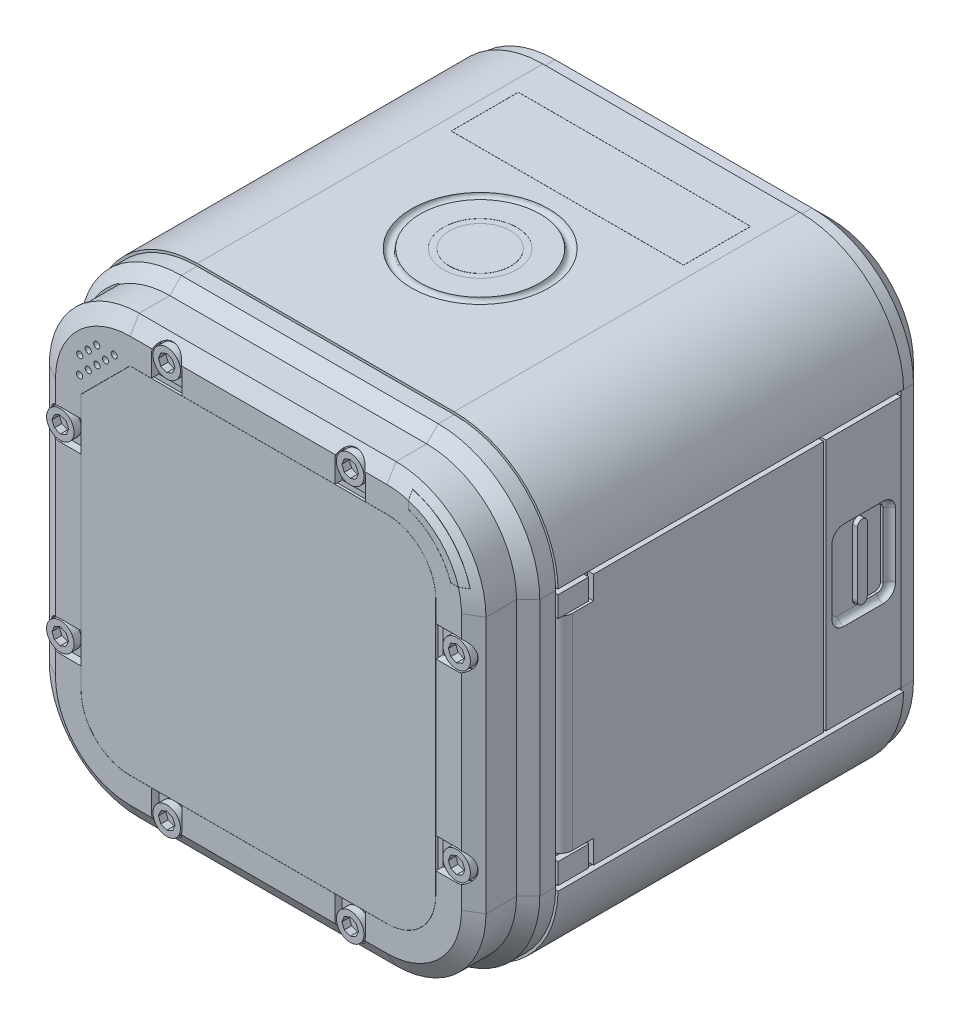
from build123d import *

# Parameters (mm, degrees)
BOSS_EXTRUDE1_DEPTH  = 18.125
FILLET1_R            = 8.5
CUT_EXTRUDE1_DEPTH   = 5.5
SKETCH5_R            = 0.3600000000000003
CUT_EXTRUDE3_DEPTH   = 1
CUT_EXTRUDE4_DEPTH   = 1
CUT_EXTRUDE5_START   = -2.5
CUT_EXTRUDE5_DEPTH   = 2.5
CHAMFER1_SIZE        = 1.5
CUT_EXTRUDE6_DEPTH   = 0.7
SKETCH10_R           = 0.19999999999999993
SKETCH10_R_2         = 0.19999999999999912
SKETCH10_R_3         = 0.20000000000000076
SKETCH10_R_4         = 0.1999999999999986
CUT_EXTRUDE7_DEPTH   = 0.6
SKETCH14_R           = 36.42270023932327
CUT_EXTRUDE8_DEPTH   = 3.25
CHAMFER3_SIZE        = 0.95
SKETCH17_R           = 0.24999999999999958
SKETCH17_R_2         = 0.24999999999999642
SKETCH17_R_3         = 0.24999999999999523
CUT_EXTRUDE9_DEPTH   = 0.5
SKETCH18_R           = 11.5
CUT_EXTRUDE10_DEPTH  = 1.5
SKETCH19_R           = 6
BOSS_EXTRUDE2_DEPTH  = 0.1
SKETCH21_W           = 28.249999999999996
SKETCH21_H           = 0.40000000000000036
CUT_EXTRUDE12_DEPTH  = 0.1
BOSS_EXTRUDE3_DEPTH  = 0.1
SKETCH25_W           = 6.149999999999997
SKETCH25_H           = 20.60000000000001
CUT_EXTRUDE15_DEPTH  = 0.5
FILLET2_R            = 1
CUT_EXTRUDE16_DEPTH  = 0.5
FILLET3_R            = 0.5
SKETCH27_R           = 3
SKETCH27_R_2         = 2.5000000000000004
CUT_EXTRUDE17_DEPTH  = 0.01
CUT_EXTRUDE18_DEPTH  = 0.2
BOSS_EXTRUDE4_DEPTH  = 0.5
BOSS_EXTRUDE5_DEPTH  = 0.5
CUT_EXTRUDE19_DEPTH  = 0.6
SKETCH33_R           = 1.1250000000000007
BOSS_EXTRUDE7_DEPTH  = 0.6
CIRPATTERN1_COUNT    = 4
SKETCH35_R           = 6.999999999999999
SKETCH35_R_2         = 4.000000000000001
CUT_EXTRUDE21_DEPTH  = 1.2
CUT_EXTRUDE22_DEPTH  = 1
BOSS_EXTRUDE8_DEPTH  = 0.2
BOSS_EXTRUDE10_DEPTH = 0.2
CUT_EXTRUDE24_DEPTH  = 2.5
BOSS_EXTRUDE11_DEPTH = 1
CHAMFER4_SIZE        = 0.35
CHAMFER4_SIZE2       = 0.582497818822684
CUT_EXTRUDE25_DEPTH  = 1.5
BOSS_EXTRUDE12_DEPTH = 1.5
CHAMFER5_SIZE        = 0.6


# Read off the part's stored shape, not the designer's step: Dome1
# Some blends are built 0.0001 mm under size
with BuildPart() as part:
    # Sketch1 → Boss-Extrude1 (new, symmetric)
    with BuildSketch(Plane.XY):
        Polygon((18.999999999999996, -18.999999999999996), (-19.000000000000004, -19.000000000000004), (-19.000000000000004, 18.999999999999996), (18.999999999999996, 19.000000000000004), align=None)
    extrude(amount=BOSS_EXTRUDE1_DEPTH, both=True)

    # Fillet1
    fillet1_edges = [part.edges().sort_by_distance(p)[0] for p in [
        (-19.000000000000004, 18.999999999999996, 0),
        (18.999999999999996, 19.000000000000004, 0),
        (18.999999999999996, -18.999999999999996, 0),
        (-19.000000000000004, -19.000000000000004, 0),
    ]]
    fillet(fillet1_edges, radius=FILLET1_R)

    # Sketch2 → Cut-Extrude1 (cut)
    with BuildSketch(Plane.XY.offset(18.125)):
        with BuildLine():
            Line((10.499999999999993, 19.000000000000004), (-10.500000000000002, 18.999999999999996))
            ThreePointArc((-10.500000000000002, 18.999999999999996), (-16.510407640085656, 16.51040764008565), (-19.000000000000004, 10.499999999999995))
            Line((-19.000000000000004, 10.499999999999995), (-19.000000000000004, -10.5))
            ThreePointArc((-19.000000000000004, -10.5), (-16.51040764008566, -16.510407640085653), (-10.500000000000002, -19.000000000000004))
            Line((-10.500000000000002, -19.000000000000004), (10.499999999999996, -18.999999999999996))
            ThreePointArc((10.499999999999996, -18.999999999999996), (16.51040764008565, -16.51040764008565), (18.999999999999996, -10.499999999999996))
            Line((18.999999999999996, -10.499999999999996), (18.999999999999996, 10.500000000000002))
            ThreePointArc((18.999999999999996, 10.500000000000002), (16.51040764008565, 16.510407640085656), (10.499999999999993, 19.000000000000004))
        make_face()
        with BuildLine():
            Line((-18.800000000000004, 10.499999999999996), (-18.800000000000004, -10.500000000000002))
            ThreePointArc((-18.800000000000004, -10.500000000000002), (-16.368986283848347, -16.368986283848347), (-10.500000000000004, -18.8))
            Line((-10.500000000000004, -18.8), (10.499999999999995, -18.800000000000004))
            ThreePointArc((10.499999999999995, -18.800000000000004), (16.368986283848344, -16.368986283848347), (18.799999999999997, -10.499999999999998))
            Line((18.799999999999997, -10.499999999999998), (18.799999999999997, 10.5))
            ThreePointArc((18.799999999999997, 10.5), (16.36898628384834, 16.368986283848347), (10.499999999999993, 18.8))
            Line((10.499999999999993, 18.8), (-10.500000000000002, 18.799999999999997))
            ThreePointArc((-10.500000000000002, 18.799999999999997), (-16.368986283848347, 16.36898628384834), (-18.800000000000004, 10.499999999999996))
        make_face(mode=Mode.SUBTRACT)
    extrude(amount=-CUT_EXTRUDE1_DEPTH, mode=Mode.SUBTRACT)

    # Sketch5 → Cut-Revolve1 (revolve, cut)
    with BuildSketch(Plane.XY):
        with Locations((-5.25, 18.999999999999996)):
            Circle(SKETCH5_R)
    revolve(axis=Axis((0, 0, 0), (0, 1, 0)), mode=Mode.SUBTRACT)

    # Sketch6 → Cut-Extrude3 (cut)
    with BuildSketch(Plane(origin=(-3.47e-15, 19, 0), x_dir=(1, 1.8e-16, 0), z_dir=(-1.8e-16, 1, 0))):
        Polygon((-9.499999999999995, 12.624999999999998), (9.500000000000005, 12.624999999999996), (9.500000000000005, 7.124999999999999), (-9.499999999999996, 7.124999999999999), align=None)
    extrude(amount=-CUT_EXTRUDE3_DEPTH, mode=Mode.SUBTRACT)

    # Sketch7 → Cut-Extrude4 (cut)
    with BuildSketch(Plane.XY.offset(18.125)):
        with BuildLine():
            Line((-14.5, 10.5), (-10.5, 14.5))
            Line((-10.5, 14.5), (10.499999999999975, 14.5))
            ThreePointArc((10.499999999999975, 14.5), (13.328427124746192, 13.32842712474619), (14.5, 10.499999999999973))
            Line((14.5, 10.499999999999973), (14.500000000000004, -10.499999999999973))
            ThreePointArc((14.500000000000004, -10.499999999999973), (13.328427124746192, -13.32842712474619), (10.499999999999975, -14.5))
            Line((10.499999999999975, -14.5), (-10.49999999999997, -14.5))
            ThreePointArc((-10.49999999999997, -14.5), (-13.328427124746188, -13.32842712474619), (-14.499999999999996, -10.499999999999973))
            Line((-14.499999999999996, -10.499999999999973), (-14.5, 10.5))
        make_face()
    extrude(amount=-CUT_EXTRUDE4_DEPTH, mode=Mode.SUBTRACT)

    # Sketch8 → Cut-Extrude5 (cut)
    with BuildSketch(Plane(origin=(0, 0, -18.125), x_dir=(-1, 0, 0), z_dir=(0, 0, -1)).offset(CUT_EXTRUDE5_START)):
        with BuildLine():
            ThreePointArc((-18.999999999999993, -10.499999999999996), (-16.51040764008565, -16.510407640085653), (-10.499999999999996, -19))
            Line((-10.499999999999996, -18.999999999999996), (10.5, -19.000000000000004))
            ThreePointArc((10.499999999999998, -19), (16.510407640085653, -16.510407640085656), (19, -10.500000000000004))
            Line((19.000000000000004, -10.500000000000002), (19.000000000000004, 10.499999999999998))
            ThreePointArc((19, 10.499999999999998), (16.510407640085656, 16.510407640085653), (10.500000000000002, 19))
            Line((10.500000000000004, 18.999999999999996), (-10.499999999999993, 19.000000000000004))
            ThreePointArc((-10.499999999999995, 19), (-16.51040764008565, 16.510407640085656), (-18.999999999999996, 10.500000000000004))
            Line((-18.999999999999996, 10.500000000000002), (-18.999999999999996, -10.499999999999998))
        make_face()
        with BuildLine():
            ThreePointArc((10.500000000000002, 18.799999999999997), (16.368986283848344, 16.36898628384834), (18.800000000000004, 10.499999999999996))
            Line((18.800000000000004, 10.499999999999996), (18.800000000000004, -10.499999999999996))
            ThreePointArc((18.800000000000004, -10.499999999999996), (16.36898628384835, -16.368986283848344), (10.500000000000004, -18.8))
            Line((10.500000000000004, -18.8), (-10.499999999999996, -18.800000000000004))
            ThreePointArc((-10.499999999999996, -18.800000000000004), (-16.36898628384834, -16.368986283848344), (-18.799999999999997, -10.499999999999998))
            Line((-18.799999999999997, -10.499999999999998), (-18.799999999999997, 10.500000000000002))
            ThreePointArc((-18.799999999999997, 10.500000000000002), (-16.368986283848336, 16.368986283848344), (-10.499999999999993, 18.8))
            Line((-10.499999999999991, 18.8), (10.500000000000002, 18.799999999999997))
        make_face(mode=Mode.SUBTRACT)
    extrude(amount=CUT_EXTRUDE5_DEPTH, mode=Mode.SUBTRACT)

    # Chamfer1
    chamfer1_edges = [part.edges().sort_by_distance(p)[0] for p in [
        (-16.368986283848344, 16.368986283848336, -18.125),
        (-5.33e-15, 18.799999999999997, -18.125),
        (16.368986283848336, 16.368986283848344, -18.125),
        (18.799999999999997, 1.78e-15, -18.125),
        (16.36898628384834, -16.368986283848344, -18.125),
        (-3.55e-15, -18.800000000000004, -18.125),
        (-16.36898628384835, -16.368986283848344, -18.125),
        (-18.800000000000004, 0, -18.125),
    ]]
    chamfer(chamfer1_edges, length=CHAMFER1_SIZE)

    # Sketch9 → Cut-Extrude6 (cut)
    with BuildSketch(Plane(origin=(0, 0, -18.125), x_dir=(-1, 0, 0), z_dir=(0, 0, -1))):
        with BuildLine():
            Line((-2.9999999999999933, -13.499999999999995), (3.0000000000000058, -13.499999999999995))
            ThreePointArc((3.0000000000000058, -13.499999999999995), (4.060660171779827, -13.939339828220174), (4.500000000000004, -14.999999999999995))
            Line((4.500000000000004, -14.999999999999995), (4.500000000000007, -18.999999999999996))
            Line((4.500000000000007, -18.999999999999996), (-4.499999999999993, -18.999999999999996))
            Line((-4.499999999999993, -18.999999999999996), (-4.499999999999994, -14.999999999999995))
            ThreePointArc((-4.499999999999994, -14.999999999999995), (-4.060660171779815, -13.939339828220174), (-2.9999999999999933, -13.499999999999995))
        make_face()
    extrude(amount=-CUT_EXTRUDE6_DEPTH, mode=Mode.SUBTRACT)

    # Sketch10 → Cut-Extrude7 (cut)
    with BuildSketch(Plane(origin=(0, 0, -18.125), x_dir=(-1, 0, 0), z_dir=(0, 0, -1))):
        with Locations((-7.999999999999993, -14.199999999999998)):
            Circle(SKETCH10_R)
        with Locations((-8.699999999999992, -14.200000000000003)):
            Circle(SKETCH10_R_2)
        with Locations((-9.399999999999993, -14.200000000000008)):
            Circle(SKETCH10_R_3)
        with Locations((-8.699999999999985, -14.900000000000002)):
            Circle(SKETCH10_R_2)
        with Locations((-9.399999999999986, -14.900000000000007)):
            Circle(SKETCH10_R_3)
        with Locations((-8.699999999999978, -15.600000000000003)):
            Circle(SKETCH10_R_2)
        with Locations((-9.399999999999977, -15.600000000000007)):
            Circle(SKETCH10_R_4)
        with Locations((-7.999999999999987, -14.899999999999997)):
            Circle(SKETCH10_R)
        with Locations((-7.99999999999998, -15.599999999999998)):
            Circle(SKETCH10_R_3)
    extrude(amount=-CUT_EXTRUDE7_DEPTH, mode=Mode.SUBTRACT)

    # Sketch14 → Cut-Extrude8 (cut)
    with BuildSketch(Plane.XY.offset(18.125)):
        Circle(SKETCH14_R)
        with BuildLine():
            Line((10.499999999999996, -17.85), (-10.5, -17.850000000000005))
            ThreePointArc((-10.5, -17.850000000000005), (-15.69723484172113, -15.697234841721126), (-17.850000000000005, -10.5))
            Line((-17.850000000000005, -10.5), (-17.850000000000005, 10.499999999999995))
            ThreePointArc((-17.850000000000005, 10.499999999999995), (-15.697234841721126, 15.69723484172112), (-10.500000000000002, 17.849999999999994))
            Line((-10.500000000000002, 17.849999999999994), (10.499999999999993, 17.849999999999994))
            ThreePointArc((10.499999999999993, 17.849999999999994), (15.697234841721121, 15.697234841721126), (17.849999999999998, 10.5))
            Line((17.849999999999998, 10.5), (17.849999999999998, -10.499999999999996))
            ThreePointArc((17.849999999999998, -10.499999999999996), (15.697234841721123, -15.697234841721123), (10.499999999999996, -17.85))
        make_face(mode=Mode.SUBTRACT)
    extrude(amount=-CUT_EXTRUDE8_DEPTH, mode=Mode.SUBTRACT)

    # Chamfer3
    chamfer3_edges = [part.edges().sort_by_distance(p)[0] for p in [
        (-18.800000000000004, -3.55e-15, 14.875),
        (-16.368986283848347, 16.36898628384834, 14.875),
        (-3.55e-15, 18.8, 14.875),
        (16.368986283848344, 16.368986283848347, 14.875),
        (18.799999999999997, 8.9e-16, 14.875),
        (16.368986283848344, -16.368986283848347, 14.875),
        (-3.55e-15, -18.800000000000004, 14.875),
        (-16.36898628384835, -16.368986283848347, 14.875),
    ]]
    chamfer(chamfer3_edges, length=CHAMFER3_SIZE - 0.0001)  # a hair under: the kernel refuses the full size

    # Cut-Sweep1: sweep along a path in Sketch16
    with BuildLine(Plane.XY.offset(18.125)) as cut_sweep1_path:
        Line((10.499999999999993, 17.849999999999998), (-10.500000000000002, 17.849999999999994))
        ThreePointArc((-10.500000000000002, 17.849999999999994), (-15.697234841721126, 15.69723484172112), (-17.850000000000005, 10.499999999999995))
        Line((-17.850000000000005, 10.499999999999995), (-17.850000000000005, -10.5))
        ThreePointArc((-17.850000000000005, -10.5), (-15.69723484172113, -15.697234841721126), (-10.500000000000004, -17.850000000000005))
        Line((-10.500000000000004, -17.850000000000005), (10.499999999999996, -17.85))
        ThreePointArc((10.499999999999996, -17.85), (15.697234841721123, -15.697234841721123), (17.849999999999998, -10.499999999999996))
        Line((17.849999999999998, -10.499999999999996), (17.849999999999998, 10.5))
        ThreePointArc((17.849999999999998, 10.5), (15.697234841721121, 15.697234841721126), (10.499999999999993, 17.849999999999998))
    # Sketch15 → Cut-Sweep1 (sweep, cut)
    with BuildSketch(Plane(origin=(0, 0, 0), x_dir=(0, 0, -1), z_dir=(1, 0, 0))):
        Polygon((-17.374999999999996, 17.849999999999998), (-18.125, 16.599999999999998), (-18.125, 17.849999999999998), align=None)
    sweep(path=cut_sweep1_path.line, mode=Mode.SUBTRACT)

    # Sketch17 → Cut-Extrude9 (cut)
    with BuildSketch(Plane.XY.offset(18.125)):
        with Locations((-13.207106781186555, 13.20710678118654)):
            Circle(SKETCH17_R)
        with Locations((-13.9142135623731, 13.914213562373089)):
            Circle(SKETCH17_R)
        with Locations((-12.5, 13.914213562373089)):
            Circle(SKETCH17_R_2)
        with Locations((-11.79289321881345, 14.621320343559635)):
            Circle(SKETCH17_R_3)
        with Locations((-13.219196934338994, 14.609230190407194)):
            Circle(SKETCH17_R)
        with Locations(Location((-14.621320343559637, 11.792893218813454, 0), (0, 0, 180))):
            Circle(SKETCH17_R)
        with Locations(Location((-13.914213562373089, 12.5, 0), (0, 0, 180))):
            Circle(SKETCH17_R)
        with Locations(Location((-14.609230190407205, 13.219196934338994, 0), (0, 0, 180))):
            Circle(SKETCH17_R)
    extrude(amount=-CUT_EXTRUDE9_DEPTH, mode=Mode.SUBTRACT)

    # Sketch18 → Cut-Extrude10 (cut)
    with BuildSketch(Plane.XY.offset(17.124999999999996)):
        Circle(SKETCH18_R)
    extrude(amount=-CUT_EXTRUDE10_DEPTH, mode=Mode.SUBTRACT)

    # Sketch19 → Boss-Extrude2 (add)
    with BuildSketch(Plane.XY.offset(15.624999999999998)):
        Circle(SKETCH19_R)
    extrude(amount=BOSS_EXTRUDE2_DEPTH)

    # Dome1 outline → Dome1 (revolve)
    with BuildSketch(Plane.XZ):
        with BuildLine():
            add(Edge.make_bspline(
                [(0, 17.725), (5.999999999999998, 17.725), (6, 15.725)],
                knots=[4.71238898038469, 4.71238898038469, 4.71238898038469, 6.283185307179586, 6.283185307179586, 6.283185307179586], degree=2, weights=[1, 0.7071067811865476, 1]))
            Line((0, 17.725), (0, 15.725))
            Line((0, 15.725), (6, 15.725))
        make_face()
    revolve(axis=Axis((0, 0, 0), (0, 0, 1)))

    # Sketch21 → Cut-Extrude12 (cut)
    with BuildSketch(Plane.ZY.offset(19.000000000000004)):
        with Locations((-1.5, 10.499999999999996)):
            Rectangle(SKETCH21_W, SKETCH21_H)
        with Locations((-1.5, -10.499999999999996)):
            Rectangle(SKETCH21_W, SKETCH21_H)
    extrude(amount=-CUT_EXTRUDE12_DEPTH, mode=Mode.SUBTRACT)

    # Sketch24 → Boss-Extrude3 (add)
    with BuildSketch(Plane.XY.offset(17.124999999999996)):
        with BuildLine():
            Line((10.500000000000002, -11.874999999999998), (-10.499999999999996, -11.875000000000002))
            ThreePointArc((-10.499999999999996, -11.875000000000002), (-11.472271824131502, -11.472271824131505), (-11.875, -10.5))
            Line((-11.875, -10.5), (-11.875000000000004, 9.235912703473977))
            Line((-11.875000000000004, 9.235912703473977), (-9.23591270347399, 11.874999999999998))
            Line((-9.23591270347399, 11.874999999999998), (10.500000000000002, 11.875000000000002))
            ThreePointArc((10.500000000000002, 11.875000000000002), (11.472271824131504, 11.472271824131502), (11.875, 10.5))
            Line((11.875, 10.5), (11.875, -10.500000000000002))
            ThreePointArc((11.875, -10.500000000000002), (11.472271824131502, -11.472271824131502), (10.500000000000002, -11.874999999999998))
        make_face()
        with BuildLine():
            Line((-9.153069990999368, 11.675), (-11.674999999999999, 9.153069990999368))
            Line((-11.674999999999999, 9.153069990999368), (-11.674999999999999, -10.5))
            ThreePointArc((-11.674999999999999, -10.5), (-11.33085046789419, -11.330850467894194), (-10.499999999999996, -11.675000000000002))
            Line((-10.499999999999996, -11.675000000000002), (10.500000000000002, -11.674999999999997))
            ThreePointArc((10.500000000000002, -11.674999999999997), (11.330850467894193, -11.330850467894193), (11.674999999999999, -10.500000000000002))
            Line((11.674999999999999, -10.500000000000002), (11.674999999999999, 10.500000000000002))
            ThreePointArc((11.674999999999999, 10.500000000000002), (11.330850467894193, 11.330850467894193), (10.500000000000002, 11.674999999999999))
            Line((10.500000000000002, 11.674999999999999), (-9.153069990999368, 11.675))
        make_face(mode=Mode.SUBTRACT)
    extrude(amount=BOSS_EXTRUDE3_DEPTH)

    # Sketch25 → Cut-Extrude15 (cut)
    with BuildSketch(Plane(origin=(18.999999999999996, 0, 0), x_dir=(0, 0, -1), z_dir=(1, 0, 0))):
        Polygon((-12.625000000001837, 10.699999999999992), (15.624999999999998, 10.700000000000003), (15.624999999999998, 10.300000000000004), (15.625, -10.299999999999994), (15.625, -10.699999999999992), (-12.625000000001837, -10.699999999999992), (-12.625000000001837, -10.299999999999994), (-10.124999999999998, -10.300000000000004), (-10.124999999999998, -8.600000000000003), (-12.624999999999996, -8.60000000000001), (-12.624999999999998, 8.600000000000003), (-10.124999999999998, 8.600000000000003), (-10.124999999999998, 10.300000000000004), (-12.625000000001837, 10.299999999999994), align=None)
        Polygon((-9.724999999999998, 10.300000000000004), (-9.724999999999998, 8.600000000000003), (-9.724999999999998, 8.400000000000007), (-12.325, 8.400000000000002), (-12.324999999999996, -8.40000000000001), (-9.724999999999998, -8.400000000000007), (-9.724999999999998, -8.600000000000003), (-9.724999999999998, -10.300000000000004), (9.074999999999998, -10.300000000000004), (9.074999999999998, 10.300000000000004), align=None, mode=Mode.SUBTRACT)
        with Locations((12.349999999999998, 0)):
            Rectangle(SKETCH25_W, SKETCH25_H, mode=Mode.SUBTRACT)
    extrude(amount=-CUT_EXTRUDE15_DEPTH, mode=Mode.SUBTRACT)

    # Fillet2
    # the kernel refuses this fillet: 1 mm, written as the material it takes off along each edge
    with BuildSketch(Plane(origin=(18.999999999999996, 8.400000000000002, 12.325), x_dir=(-1, 0, -7.105e-14), z_dir=(0, -1, -2.1e-16))) as fillet2_piece_1:
        with BuildLine():
            CenterArc((1.0000000000000615, 0.8660254037844162), FILLET2_R, 179.99999999999594, 60.00000000000142)
            Line((6.153e-14, 0.8660254037844872), (0, 0))
            Line((0, 0), (0.5000000000000213, 0))
        make_face()
    extrude(amount=16.80000000000001, mode=Mode.SUBTRACT)

    # Sketch26 → Cut-Extrude16 (cut)
    with BuildSketch(Plane(origin=(18.999999999999996, 0, 0), x_dir=(0, 0, -1), z_dir=(1, 0, 0))):
        with BuildLine():
            Line((10.750000000000007, -3.625), (13.949999999999992, -3.625))
            ThreePointArc((13.949999999999992, -3.625), (14.657106781186547, -3.332106781186548), (14.95, -2.6249999999999933))
            Line((14.95, -2.6249999999999933), (14.95, 2.624999999999993))
            ThreePointArc((14.95, 2.624999999999993), (14.657106781186547, 3.332106781186548), (13.949999999999992, 3.625))
            Line((13.949999999999992, 3.625), (10.750000000000007, 3.625))
            ThreePointArc((10.750000000000007, 3.625), (10.042893218813452, 3.3321067811865475), (9.75, 2.624999999999993))
            Line((9.75, 2.624999999999993), (9.75, -2.6249999999999933))
            ThreePointArc((9.75, -2.6249999999999933), (10.042893218813452, -3.3321067811865475), (10.750000000000007, -3.625))
        make_face()
    extrude(amount=-CUT_EXTRUDE16_DEPTH, mode=Mode.SUBTRACT)

    # Fillet3
    fillet3_edges = [part.edges().sort_by_distance(p)[0] for p in [
        (18.499999999999996, 0, -9.75),
        (18.499999999999996, 3.332106781186548, -10.042893218813452),
        (18.499999999999996, 3.625, -12.35),
        (18.499999999999996, 3.332106781186548, -14.657106781186547),
        (18.499999999999996, -4.4e-16, -14.95),
        (18.499999999999996, -3.332106781186548, -14.657106781186547),
        (18.499999999999996, -3.625, -12.35),
        (18.499999999999996, -3.332106781186548, -10.042893218813452),
    ]]
    fillet(fillet3_edges, radius=FILLET3_R - 0.0001)  # a hair under: the kernel refuses the full size

    # Sketch27 → Cut-Extrude17 (cut)
    with BuildSketch(Plane(origin=(-3.47e-15, 19, 0), x_dir=(1, 1.8e-16, 0), z_dir=(-1.8e-16, 1, 0))):
        with Locations(Location((3.47e-15, 0, 0), (0, 0, 180))):
            Circle(SKETCH27_R)
        with Locations(Location((3.47e-15, 0, 0), (0, 0, 180))):
            Circle(SKETCH27_R_2, mode=Mode.SUBTRACT)
    extrude(amount=-CUT_EXTRUDE17_DEPTH, mode=Mode.SUBTRACT)

    # Sketch29 → Cut-Extrude18 (cut)
    with BuildSketch(Plane(origin=(18.499999999999996, 0, 0), x_dir=(0, 0, -1), z_dir=(1, 0, 0))):
        with BuildLine():
            Line((12.449999999999998, -3.125), (13.95, -3.125))
            ThreePointArc((13.95, -3.125), (14.303553390593272, -2.978553390593274), (14.45, -2.625))
            Line((14.45, -2.625), (14.45, 2.625))
            ThreePointArc((14.45, 2.625), (14.303553390593274, 2.9785533905932726), (13.950000000000001, 3.125))
            Line((13.950000000000001, 3.125), (12.449999999999996, 3.125))
            ThreePointArc((12.449999999999996, 3.125), (12.096446609406723, 2.9785533905932726), (11.949999999999998, 2.625))
            Line((11.949999999999998, 2.625), (11.949999999999998, -2.625))
            ThreePointArc((11.949999999999998, -2.625), (12.096446609406724, -2.978553390593274), (12.449999999999998, -3.125))
        make_face()
    extrude(amount=-CUT_EXTRUDE18_DEPTH, mode=Mode.SUBTRACT)

    # Sketch30 → Boss-Extrude4 (add)
    with BuildSketch(Plane(origin=(18.299999999999997, 0, 0), x_dir=(0, 0, -1), z_dir=(1, 0, 0))):
        with BuildLine():
            Line((12.049999999999997, 2.625), (12.049999999999997, -2.625))
            ThreePointArc((12.049999999999997, -2.625), (12.449999999999998, -3.0250000000000004), (12.849999999999998, -2.625))
            Line((12.849999999999998, -2.625), (12.849999999999994, 2.6250000000000004))
            ThreePointArc((12.849999999999994, 2.6250000000000004), (12.449999999999996, 3.0249999999999986), (12.049999999999997, 2.625))
        make_face()
    extrude(amount=BOSS_EXTRUDE4_DEPTH)

    # Sketch31 → Boss-Extrude5 (add)
    with BuildSketch(Plane(origin=(0, 0, -17.425), x_dir=(-1, 0, 0), z_dir=(0, 0, -1))):
        with BuildLine():
            Line((3.0000000000000058, -13.999999999999995), (-2.9999999999999933, -13.999999999999995))
            ThreePointArc((-2.9999999999999933, -13.999999999999995), (-3.707106781186541, -14.292893218813447), (-3.9999999999999933, -14.999999999999995))
            Line((-3.9999999999999933, -14.999999999999995), (-3.9999999999999933, -15.7))
            ThreePointArc((-3.9999999999999933, -15.7), (-3.707106781186541, -16.407106781186545), (-2.9999999999999933, -16.7))
            Line((-2.9999999999999933, -16.7), (3.000000000000006, -16.699999999999996))
            ThreePointArc((3.000000000000006, -16.699999999999996), (3.7071067811865532, -16.407106781186545), (4.000000000000005, -15.7))
            Line((4.000000000000005, -15.7), (4.000000000000005, -14.999999999999995))
            ThreePointArc((4.000000000000005, -14.999999999999995), (3.7071067811865532, -14.292893218813447), (3.0000000000000058, -13.999999999999995))
        make_face()
    extrude(amount=BOSS_EXTRUDE5_DEPTH)

    # Sketch32 → Cut-Extrude19 (cut)
    with BuildSketch(Plane.XY.offset(18.125)):
        with BuildLine():
            Line((-6.250000000000001, 16.199999999999996), (-6.249999999999998, 14.5))
            Line((-6.249999999999998, 14.5), (-8.75, 14.5))
            Line((-8.75, 14.5), (-8.749999999999998, 16.199999999999996))
            ThreePointArc((-8.749999999999998, 16.199999999999996), (-7.500000000000002, 17.449999999999996), (-6.250000000000001, 16.199999999999996))
        make_face()
        with BuildLine():
            Line((8.749999999999995, 14.500000000000004), (8.749999999999993, 16.200000000000003))
            ThreePointArc((8.749999999999993, 16.200000000000003), (7.499999999999991, 17.449999999999996), (6.249999999999995, 16.199999999999996))
            Line((6.249999999999995, 16.199999999999996), (6.249999999999994, 14.500000000000004))
            Line((6.249999999999994, 14.500000000000004), (8.749999999999995, 14.500000000000004))
        make_face()
        with BuildLine():
            Line((14.499999999999973, -8.750000000000044), (16.19999999999997, -8.75000000000005))
            ThreePointArc((16.19999999999997, -8.75000000000005), (17.449999999999967, -7.500000000000052), (16.199999999999974, -6.250000000000051))
            Line((16.199999999999974, -6.250000000000051), (14.499999999999982, -6.2500000000000435))
            Line((14.499999999999982, -6.2500000000000435), (14.499999999999973, -8.750000000000044))
        make_face()
        with BuildLine():
            Line((16.200000000000017, 6.249999999999945), (14.500000000000023, 6.2499999999999485))
            Line((14.500000000000023, 6.2499999999999485), (14.500000000000032, 8.74999999999995))
            Line((14.500000000000032, 8.74999999999995), (16.200000000000028, 8.749999999999941))
            ThreePointArc((16.200000000000028, 8.749999999999941), (17.450000000000024, 7.49999999999994), (16.200000000000017, 6.249999999999945))
        make_face()
        with BuildLine():
            Line((-8.750000000000096, -14.499999999999947), (-8.750000000000107, -16.199999999999942))
            ThreePointArc((-8.750000000000107, -16.199999999999942), (-7.500000000000115, -17.449999999999946), (-6.250000000000108, -16.199999999999953))
            Line((-6.250000000000108, -16.199999999999953), (-6.250000000000097, -14.499999999999964))
            Line((-6.250000000000097, -14.499999999999964), (-8.750000000000096, -14.499999999999947))
        make_face()
        with BuildLine():
            Line((6.249999999999886, -16.200000000000045), (6.249999999999895, -14.500000000000048))
            Line((6.249999999999895, -14.500000000000048), (8.749999999999899, -14.500000000000066))
            Line((8.749999999999899, -14.500000000000066), (8.749999999999885, -16.200000000000063))
            ThreePointArc((8.749999999999885, -16.200000000000063), (7.499999999999878, -17.450000000000053), (6.249999999999886, -16.200000000000045))
        make_face()
        with BuildLine():
            Line((-14.499999999999913, 8.750000000000146), (-16.199999999999914, 8.750000000000162))
            ThreePointArc((-16.199999999999914, 8.750000000000162), (-17.449999999999918, 7.500000000000171), (-16.19999999999993, 6.250000000000164))
            Line((-16.19999999999993, 6.250000000000164), (-14.499999999999938, 6.250000000000145))
            Line((-14.499999999999938, 6.250000000000145), (-14.499999999999913, 8.750000000000146))
        make_face()
        with BuildLine():
            Line((-16.200000000000063, -6.249999999999831), (-14.500000000000068, -6.249999999999847))
            Line((-14.500000000000068, -6.249999999999847), (-14.500000000000092, -8.749999999999849))
            Line((-14.500000000000092, -8.749999999999849), (-16.200000000000085, -8.74999999999983))
            ThreePointArc((-16.200000000000085, -8.74999999999983), (-17.450000000000074, -7.499999999999821), (-16.200000000000063, -6.249999999999831))
        make_face()
    extrude(amount=-CUT_EXTRUDE19_DEPTH, mode=Mode.SUBTRACT)

    # Sketch33 → Boss-Extrude7 (add)
    # profile 1 of 2: a face of its own
    with BuildSketch(Plane.XY.offset(17.525)):
        with Locations((-7.500000000000002, 16.199999999999996)):
            Circle(SKETCH33_R)
        Polygon((-7.021645709543641, 15.721645709543639), (-6.823504874817256, 16.2), (-7.021645709543643, 16.678354290456358), (-7.500000000000002, 16.876495125182743), (-7.978354290456369, 16.67835429045635), (-8.176495125182749, 16.19999999999999), (-7.978354290456365, 15.721645709543639), (-7.499999999999996, 15.523504874817254), align=None, mode=Mode.SUBTRACT)
    # profile 2 of 2: a face of its own
    with BuildSketch(Plane.XY.offset(17.525)):
        with Locations(Location((7.500000000000002, 16.199999999999996, 0), (0, 0, 180))):
            Circle(SKETCH33_R)
        Polygon((7.021645709543643, 16.678354290456358), (7.5, 16.876495125182743), (7.978354290456364, 16.678354290456355), (8.176495125182743, 16.199999999999996), (7.978354290456357, 15.721645709543639), (7.500000000000001, 15.523504874817252), (7.021645709543641, 15.721645709543639), (6.823504874817256, 16.2), align=None, mode=Mode.SUBTRACT)
    boss_extrude7 = extrude(amount=BOSS_EXTRUDE7_DEPTH)

    # CirPattern1: Boss-Extrude7 ×4 about axis
    cirpattern1_axis = Axis((-5.39e-15, 3e-17, 0), (0, 0, 1))
    for i in range(1, CIRPATTERN1_COUNT):
        add(boss_extrude7.rotate(cirpattern1_axis, i * 360 / CIRPATTERN1_COUNT))

    # Sketch35 → Cut-Extrude21 (cut)
    with BuildSketch(Plane.XY.offset(14.824999999999998)):
        with Locations((-17.85000000000002, -17.850000000000012)):
            Circle(SKETCH35_R)
        with Locations((-17.85000000000002, -17.850000000000012)):
            Circle(SKETCH35_R_2, mode=Mode.SUBTRACT)
    extrude(amount=CUT_EXTRUDE21_DEPTH, mode=Mode.SUBTRACT)

    # Sketch36 → Cut-Extrude22 (cut)
    with BuildSketch(Plane.XY.offset(18.125)):
        with BuildLine():
            Line((12.249999999999993, 16.967418341193028), (12.249999999999993, 15.71416340365355))
            ThreePointArc((12.249999999999993, 15.71416340365355), (14.389087296526025, 14.38908729652599), (15.714163403653565, 12.249999999999941))
            Line((15.714163403653565, 12.249999999999941), (16.96741834119304, 12.249999999999941))
            ThreePointArc((16.96741834119304, 12.249999999999941), (15.237615433949884, 15.237615433949845), (12.249999999999993, 16.967418341193028))
        make_face()
    extrude(amount=-CUT_EXTRUDE22_DEPTH, mode=Mode.SUBTRACT)

    # Sketch40 → Cut-Extrude24 (cut)
    with BuildSketch(Plane.XY.offset(14.824999999999998)):
        Polygon((-11.756688741317912, 13.781235405583626), (-16.816609685869068, 18.680645328455032), (-18.7295653847715, 16.705018720505873), (-13.669644440220342, 11.805608797634463), align=None)
    extrude(amount=CUT_EXTRUDE24_DEPTH, mode=Mode.SUBTRACT)

    # Sketch41 → Boss-Extrude11 (add)
    with BuildSketch(Plane.XY.offset(17.124999999999996)):
        with BuildLine():
            Line((15.721350400040457, 12.259999999999941), (16.95433962539934, 12.259999999999941))
            ThreePointArc((16.95433962539934, 12.259999999999941), (15.230544366138016, 15.230544366137977), (12.259999999999993, 16.95433962539933))
            Line((12.259999999999993, 16.95433962539933), (12.259999999999993, 15.721350400040444))
            ThreePointArc((12.259999999999993, 15.721350400040444), (14.396158364338053, 14.396158364338016), (15.721350400040457, 12.259999999999941))
        make_face()
    extrude(amount=BOSS_EXTRUDE11_DEPTH)

    # Chamfer4
    chamfer4_edges = [part.edges().sort_by_distance(p)[0] for p in [
        (15.230544366138014, 15.230544366137979, 18.124999999999996),
    ]]
    chamfer4_side = [part.faces().sort_by_distance(p)[0] for p in [
        (15.230544366138014, 15.230544366137979, 17.624999999999996),
    ]]
    chamfer(chamfer4_edges, length=CHAMFER4_SIZE, length2=CHAMFER4_SIZE2, reference=chamfer4_side[0])

    # Sketch42 → Cut-Extrude25 (cut)
    with BuildSketch(Plane(origin=(0, 0, -18.125), x_dir=(-1, 0, 0), z_dir=(0, 0, -1))):
        with BuildLine():
            Line((16.05675264880487, -13.250000000000004), (17.370043667983484, -13.250000000000004))
            ThreePointArc((17.370043667983484, -13.250000000000004), (15.732590180780452, -15.732590180780448), (13.250000000000009, -17.37004366798348))
            Line((13.250000000000009, -17.37004366798348), (13.250000000000009, -16.056752648804867))
            ThreePointArc((13.250000000000009, -16.056752648804867), (14.884062043356595, -14.88406204335659), (16.05675264880487, -13.250000000000004))
        make_face()
    extrude(amount=-CUT_EXTRUDE25_DEPTH, mode=Mode.SUBTRACT)

    # Sketch43 → Boss-Extrude12 (add)
    with BuildSketch(Plane(origin=(0, 0, -16.624999999999996), x_dir=(-1, 0, 0), z_dir=(0, 0, -1))):
        with BuildLine():
            Line((13.268027721237905, -17.352015946745585), (17.352015946745585, -13.268027721237905))
            ThreePointArc((17.352015946745738, -13.268027721238008), (17.353635878709422, -13.264014334634844), (17.355253459938584, -13.260000000000002))
            Line((17.355253459938584, -13.260000000000003), (16.062957846326206, -13.260000000000005))
            ThreePointArc((16.062957846326206, -13.260000000000005), (14.891133111168596, -14.891133111168593), (13.260000000000009, -16.062957846326206))
            Line((13.260000000000009, -16.062957846326206), (13.260000000000009, -17.355253459938584))
            ThreePointArc((13.260000000000009, -17.355253459938584), (13.264014334634847, -17.353635878709422), (13.268027721238008, -17.352015946745738))
        make_face()
        with BuildLine():
            ThreePointArc((13.268027721238008, -17.352015946745738), (15.725519112968584, -15.725519112968588), (17.352015946745738, -13.268027721238008))
            Line((17.352015946745585, -13.268027721237905), (13.268027721237905, -17.352015946745585))
        make_face()
    extrude(amount=BOSS_EXTRUDE12_DEPTH)

    # Chamfer5
    chamfer5_edges = [part.edges().sort_by_distance(p)[0] for p in [
        (-15.725519112953933, -15.72551911293473, -18.124999999999996),
    ]]
    chamfer(chamfer5_edges, length=CHAMFER5_SIZE)


with BuildPart() as body_2:
    # Sketch37 → Boss-Extrude8 (new body)
    with BuildSketch(Plane(origin=(-3.47e-15, 19, 0), x_dir=(1, 1.8e-16, 0), z_dir=(-1.8e-16, 1, 0))):
        Polygon((-9.489999999999997, 7.134999999999999), (9.490000000000006, 7.134999999999999), (9.490000000000006, 12.614999999999998), (-9.489999999999995, 12.615), align=None)
    extrude(amount=-BOSS_EXTRUDE8_DEPTH)


with BuildPart() as body_3:
    # Sketch39 → Boss-Extrude10 (new body)
    with BuildSketch(Plane.XY.offset(18.125)):
        with BuildLine():
            Line((8.749999999999995, 14.490000000000004), (6.249999999999994, 14.490000000000004))
            Line((6.249999999999994, 14.490000000000004), (-6.249999999999999, 14.490000000000002))
            Line((-6.249999999999999, 14.490000000000002), (-8.75, 14.490000000000002))
            Line((-8.75, 14.490000000000002), (-10.495857864376271, 14.490000000000002))
            Line((-10.495857864376271, 14.490000000000002), (-14.490000000000002, 10.495857864376271))
            Line((-14.490000000000002, 10.495857864376271), (-14.489999999999913, 8.750000000000146))
            Line((-14.489999999999913, 8.750000000000146), (-14.489999999999938, 6.250000000000145))
            Line((-14.489999999999938, 6.250000000000145), (-14.490000000000068, -6.249999999999847))
            Line((-14.490000000000068, -6.249999999999847), (-14.490000000000093, -8.749999999999849))
            Line((-14.490000000000093, -8.749999999999849), (-14.489999999999998, -10.499999999999973))
            ThreePointArc((-14.489999999999998, -10.499999999999973), (-13.321356056934322, -13.321356056934327), (-10.499999999999968, -14.49))
            Line((-10.499999999999968, -14.49), (-8.750000000000096, -14.489999999999947))
            Line((-8.750000000000096, -14.489999999999947), (-6.250000000000097, -14.489999999999965))
            Line((-6.250000000000097, -14.489999999999965), (6.249999999999895, -14.490000000000048))
            Line((6.249999999999895, -14.490000000000048), (8.749999999999899, -14.490000000000066))
            Line((8.749999999999899, -14.490000000000066), (10.499999999999973, -14.490000000000002))
            ThreePointArc((10.499999999999973, -14.490000000000002), (13.321356056934327, -13.321356056934327), (14.490000000000002, -10.499999999999973))
            Line((14.490000000000002, -10.499999999999973), (14.489999999999974, -8.750000000000044))
            Line((14.489999999999974, -8.750000000000044), (14.489999999999982, -6.2500000000000435))
            Line((14.489999999999982, -6.2500000000000435), (14.490000000000023, 6.2499999999999485))
            Line((14.490000000000023, 6.2499999999999485), (14.490000000000032, 8.74999999999995))
            Line((14.490000000000032, 8.74999999999995), (14.490000000000002, 10.499999999999977))
            ThreePointArc((14.490000000000002, 10.499999999999977), (13.321356056934325, 13.321356056934325), (10.499999999999975, 14.49))
            Line((10.499999999999975, 14.49), (8.749999999999995, 14.490000000000004))
        make_face()
    extrude(amount=-BOSS_EXTRUDE10_DEPTH)


solid = Compound([part.part, body_2.part, body_3.part])
